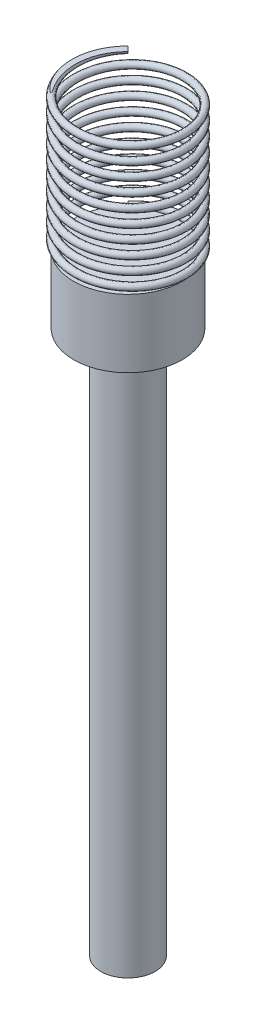
from build123d import *

# Parameters (mm, degrees)
SKETCH_1_R              = 4
EXTRUDE_1_DEPTH         = 80
SKETCH_2_R              = 8
EXTRUDE_2_DEPTH         = 10
SWEEP_1_PITCH           = 2
CUT_EXTRUDE_START       = 110
CUT_EXTRUDE_1_OUTLINE_W = 6
CUT_EXTRUDE_1_OUTLINE_H = 14
CUT_EXTRUDE_1_DEPTH     = 0.499604683


# Read off the part's stored shape, not the designer's step: 切除-拉伸1
with BuildPart() as part:
    # 草图1 → 凸台-拉伸1 (new body)
    with BuildSketch(Plane(origin=(0, 0, 0), x_dir=(1, 0, 0), z_dir=(0, 1, 0))):
        with Locations(Location((0, 0, 0), (0, 0, 270))):
            Circle(SKETCH_1_R)
    extrude(amount=EXTRUDE_1_DEPTH)

    # 草图2 → 凸台-拉伸2 (add)
    with BuildSketch(Plane(origin=(0, 80, 0), x_dir=(1, 0, 0), z_dir=(0, 1, 0))):
        with Locations(Location((0, 0, 0), (0, 0, 270))):
            Circle(SKETCH_2_R)
    extrude(amount=EXTRUDE_2_DEPTH)

    # 扫描1: the profile of 扫描1 profile screwed along a left-hand helix of 10 turns, 10 arcs to a turn; built about Z, then put on its axis
    sweep_1_z = Axis((0, 0, 0), (0, 0, 1))
    sweep_1_corners = [(8.5, 0, 0), (8, 0.019878639, 0.499604683), (7.5, 0, 0), (8, -0.019878639, -0.499604683)]
    with BuildLine(mode=Mode.PRIVATE) as sweep_1_profile:
        ThreePointArc((8.5, 0, 0), (8.353553391, 0.01405632, 0.35327386), (8, 0.019878639, 0.499604683))
        ThreePointArc((8, 0.019878639, 0.499604683), (7.646446609, 0.01405632, 0.35327386), (7.5, 0, 0))
        ThreePointArc((7.5, 0, 0), (7.646446609, -0.01405632, -0.35327386), (8, -0.019878639, -0.499604683))
        ThreePointArc((8, -0.019878639, -0.499604683), (8.353553391, -0.01405632, -0.35327386), (8.5, 0, 0))
    sweep_1_cap = Face(sweep_1_profile.wire())
    sweep_1_arcs = [((8.5, 0, 0), (8.5, 0.019878639, 0.499604683), (8, 0.019878639, 0.499604683), (1, 0.7071067811865476, 1)), ((8, 0.019878639, 0.499604683), (7.5, 0.019878639, 0.499604683), (7.5, 0, 0), (1, 0.7071067811865476, 1)), ((7.5, 0, 0), (7.5, -0.019878639, -0.499604683), (8, -0.019878639, -0.499604683), (1, 0.7071067811865476, 1)), ((8, -0.019878639, -0.499604683), (8.5, -0.019878639, -0.499604683), (8.5, 0, 0), (1, 0.7071067811865476, 1))]  # start, shoulder, end, weights
    sweep_1_turn_angles = [0, -18, -36, -54, -72, -90, -108, -126, -144, -162, -180, -198, -216, -234, -252, -270, -288, -306, -324, -342, -360]
    sweep_1_turn_weights = [1, 0.9510565162951535, 1, 0.9510565162951535, 1, 0.9510565162951535, 1, 0.9510565162951535, 1, 0.9510565162951535, 1, 0.9510565162951535, 1, 0.9510565162951535, 1, 0.9510565162951535, 1, 0.9510565162951535, 1, 0.9510565162951535, 1]
    sweep_1_turn_sides = [Face.make_bezier_surface([[Vector(p[j][0], p[j][1], 0).rotate(sweep_1_z, sweep_1_turn_angles[2 * i + k]) / sweep_1_turn_weights[2 * i + k] + Vector(0, 0, p[j][2] + -SWEEP_1_PITCH * sweep_1_turn_angles[2 * i + k] / 360) for k in range(3)] for j in range(3)], [[p[3][j] * sweep_1_turn_weights[2 * i + k] for k in range(3)] for j in range(3)]) for p in sweep_1_arcs for i in range(10)]
    sweep_1 = Plane(origin=(0, 90, 0), x_dir=(-0.7071067811865537, 0, -0.7071067811865414), z_dir=(0, 1, 0)) * Solid(Shell([*[p.moved(Location((0, 0, SWEEP_1_PITCH * i))) for i in range(10) for p in sweep_1_turn_sides], sweep_1_cap, sweep_1_cap.rotate(sweep_1_z, -3600).moved(Location((0, 0, -SWEEP_1_PITCH * -3600 / 360)))]))
    add(sweep_1)

    # 切除-拉伸1 outline → 切除-拉伸1 (cut)
    with BuildSketch(Plane(origin=(0, 0, 0), x_dir=(1, 0, 0), z_dir=(0, 1, 0)).offset(CUT_EXTRUDE_START)):
        with Locations((-7, 0)):
            Rectangle(CUT_EXTRUDE_1_OUTLINE_W, CUT_EXTRUDE_1_OUTLINE_H)
    extrude(amount=CUT_EXTRUDE_1_DEPTH, mode=Mode.SUBTRACT)


solid = part.part
